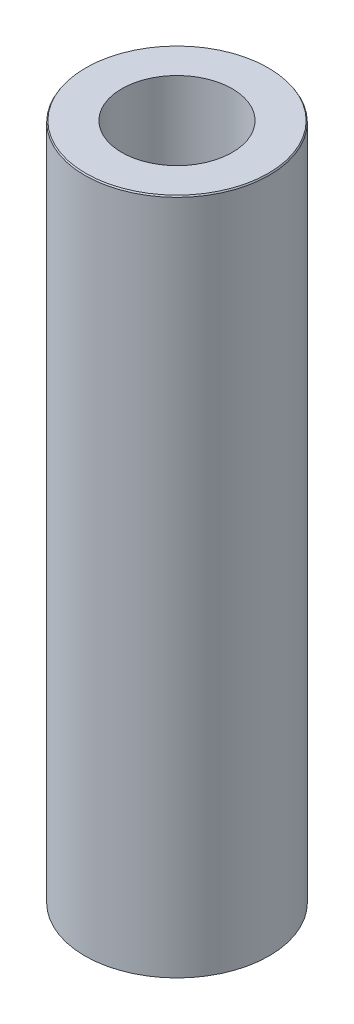
from build123d import *
from OCP.BRepFilletAPI import BRepFilletAPI_MakeChamfer

# Parameters (mm, degrees)
SKETCH1_R           = 52.5
BOSS_EXTRUDE1_DEPTH = 386.265184714
SKETCH2_R           = 31.457747451
CUT_EXTRUDE1_DEPTH  = 394.336106813
CHAMFER1_SIZE       = 0.774252962
CHAMFER1_SIZE2      = 0.481087072


with BuildPart() as part:
    # Sketch1 → Boss-Extrude1 (new body)
    with BuildSketch(Plane(origin=(0, 0, 0), x_dir=(1, 0, 0), z_dir=(0, 1, 0))):
        Circle(SKETCH1_R)
    extrude(amount=BOSS_EXTRUDE1_DEPTH)

    # Sketch2 → Cut-Extrude1 (cut, through all)
    with BuildSketch(Plane(origin=(0, 0, 0), x_dir=(1, 0, 0), z_dir=(0, 1, 0))):
        Circle(SKETCH2_R)
    extrude(amount=CUT_EXTRUDE1_DEPTH, mode=Mode.SUBTRACT)

    # Chamfer1: one chamfer whose edges measure the first distance from different faces: ONE call of the kernel's chamfer builder (chamfer() names one face for all edges)
    chamfer1_edges_1 = [part.edges().sort_by_distance(p)[0] for p in [
        (-52.5, 386.265184714, 0),
    ]]
    chamfer1_side_1 = [part.faces().sort_by_distance(p)[0] for p in [
        (-52.5, 193.132592357, 0),
    ]]
    chamfer1_edges_2 = [part.edges().sort_by_distance(p)[0] for p in [
        (-52.5, 0, 0),
    ]]
    chamfer1_side_2 = [part.faces().sort_by_distance(p)[0] for p in [
        (-51.01507576, 0, 0),
    ]]
    chamfer1 = BRepFilletAPI_MakeChamfer(part.part.solid().wrapped)
    for e in chamfer1_edges_1:
        chamfer1.Add(CHAMFER1_SIZE, CHAMFER1_SIZE2, e.wrapped, chamfer1_side_1[0].wrapped)  # the first distance lies on this face
    for e in chamfer1_edges_2:
        chamfer1.Add(CHAMFER1_SIZE, CHAMFER1_SIZE2, e.wrapped, chamfer1_side_2[0].wrapped)  # the first distance lies on this face
    add(Compound.cast(chamfer1.Shape()), mode=Mode.REPLACE)


solid = part.part
